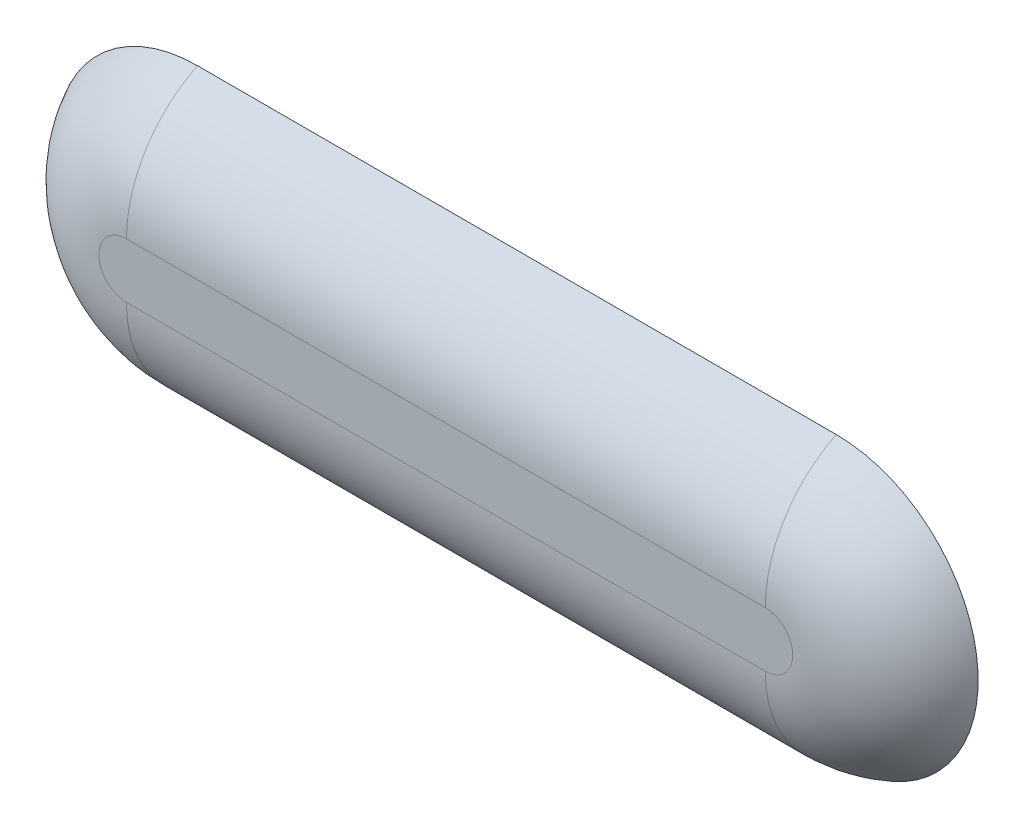
from build123d import *

# Parameters (mm, degrees)
BOSS_EXTRUDE1_DEPTH = 0.254
FILLET5_R           = 0.4572


with BuildPart() as part:
    # Sketch1 → Boss-Extrude1 (new body)
    with BuildSketch(Plane.XY):
        with BuildLine():
            Line((0, 0.508), (2.286, 0.508))
            ThreePointArc((2.286, 0.508), (2.794, 0), (2.286, -0.508))
            Line((2.286, -0.508), (0, -0.508))
            ThreePointArc((0, -0.508), (-0.508, 0), (0, 0.508))
        make_face()
    extrude(amount=BOSS_EXTRUDE1_DEPTH)

    # Fillet5
    # the kernel refuses this fillet: 0.4572 mm, written as the material it takes off along each edge
    with BuildSketch(Plane(origin=(0, 0, 0.254), x_dir=(0, -1, 0), z_dir=(1, 0, 0))) as fillet5_piece_1:
        with BuildLine():
            CenterArc((0.098437306, 0.4572), FILLET5_R, 270, 63.612200039)
            Line((0.098437306, 0), (0.098437306, -0.009144))
            Line((0.098437306, -0.009144), (0.508, -0.009144))
            Line((0.508, -0.009144), (0.517144, 0))
            ThreePointArc((0.517144, 0), (0.517144, 0.127), (0.516191254, 0.249936))
            Line((0.516191254, 0.249936), (0.508, 0.254))
        make_face()
    revolve(axis=Axis((0, 0, 0.254), (0, 0, -1)), revolution_arc=180, mode=Mode.SUBTRACT)
    with BuildSketch(Plane(origin=(2.286, -0.508, 0.254), x_dir=(0, 0, -1), z_dir=(-1, 0, 0)), Plane(origin=(0, 0.508, 0.254), x_dir=(0, 0, -1), z_dir=(1, 0, 0))) as fillet5_piece_2:
        with BuildLine():
            CenterArc((0.4572, -0.409562694), FILLET5_R, 116.387799961, 63.612200039)
            Line((0, -0.409562694), (-0.009144, -0.409562694))
            Line((-0.009144, -0.409562694), (-0.009144, 0))
            Line((-0.009144, 0), (0, 0.009144))
            ThreePointArc((0, 0.009144), (0.127, 0.009144), (0.249936, 0.008191254))
            Line((0.249936, 0.008191254), (0.254, 0))
        make_face()
    extrude(amount=2.286, mode=Mode.SUBTRACT)
    with BuildSketch(Plane(origin=(2.286, 0, 0.254), x_dir=(0, 1, 0), z_dir=(-1, 0, 0))) as fillet5_piece_3:
        with BuildLine():
            CenterArc((0.098437306, 0.4572), FILLET5_R, 270, 63.612200039)
            Line((0.098437306, 0), (0.098437306, -0.009144))
            Line((0.098437306, -0.009144), (0.508, -0.009144))
            Line((0.508, -0.009144), (0.517144, 0))
            ThreePointArc((0.517144, 0), (0.517144, 0.127), (0.516191254, 0.249936))
            Line((0.516191254, 0.249936), (0.508, 0.254))
        make_face()
    revolve(axis=Axis((2.286, 0, 0.254), (0, 0, -1)), revolution_arc=180, mode=Mode.SUBTRACT)


solid = part.part
